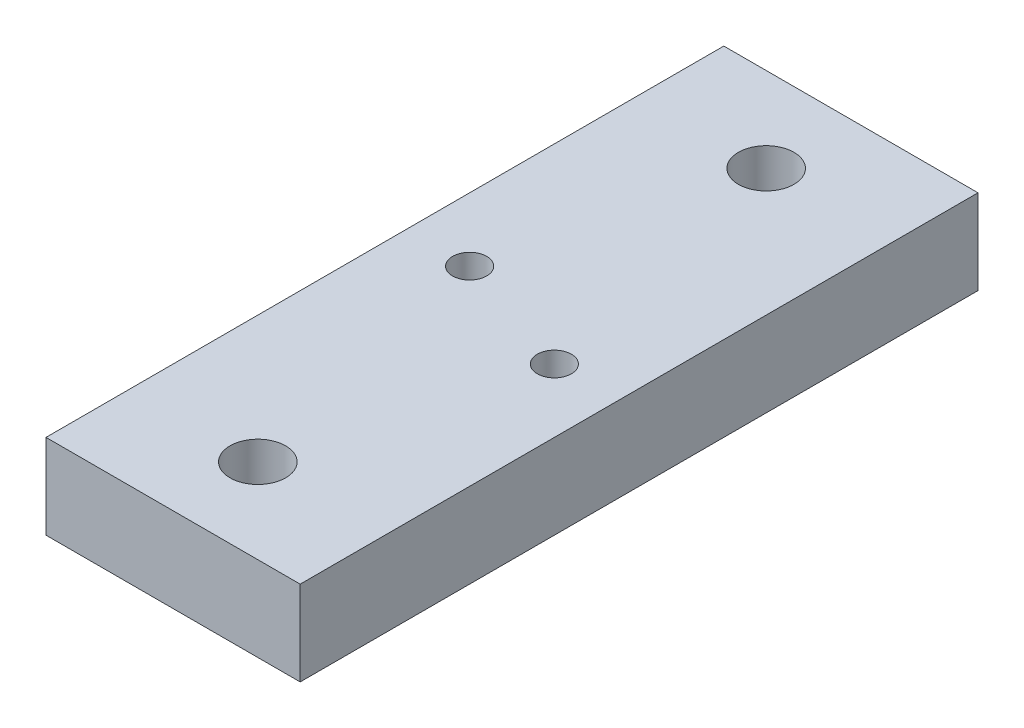
from build123d import *

# Parameters (mm, degrees)
SKETCH1_W                                   = 38.1
SKETCH1_H                                   = 101.6
SKETCH1_R                                   = 4.1656
BOSS_EXTRUDE1_DEPTH                         = 12.7
CBORE_FOR_10_HEX_MACHINE_SCREW1_D           = 5.1054
CBORE_FOR_10_HEX_MACHINE_SCREW1_CBORE_D     = 14.2875
CBORE_FOR_10_HEX_MACHINE_SCREW1_CBORE_DEPTH = 3.048


with BuildPart() as part:
    # Sketch1 → Boss-Extrude1 (new body)
    with BuildSketch(Plane(origin=(0, 0, 0), x_dir=(1, 0, 0), z_dir=(0, 1, 0))):
        with Locations((19.05, 50.8)):
            Rectangle(SKETCH1_W, SKETCH1_H)
        with Locations((19.05, 88.9)):
            Circle(SKETCH1_R, mode=Mode.SUBTRACT)
        with Locations((19.05, 12.7)):
            Circle(SKETCH1_R, mode=Mode.SUBTRACT)
    extrude(amount=BOSS_EXTRUDE1_DEPTH)

    # CBORE for #10 Hex Machine Screw1 (through all)
    with Locations(Plane(origin=(0, 0, 0), x_dir=(-1, 0, 0), z_dir=(0, -1, 0))):
        with Locations((-28.575, 47.625), (-9.525, 53.975)):
            CounterBoreHole(CBORE_FOR_10_HEX_MACHINE_SCREW1_D / 2, CBORE_FOR_10_HEX_MACHINE_SCREW1_CBORE_D / 2, CBORE_FOR_10_HEX_MACHINE_SCREW1_CBORE_DEPTH)


solid = part.part
